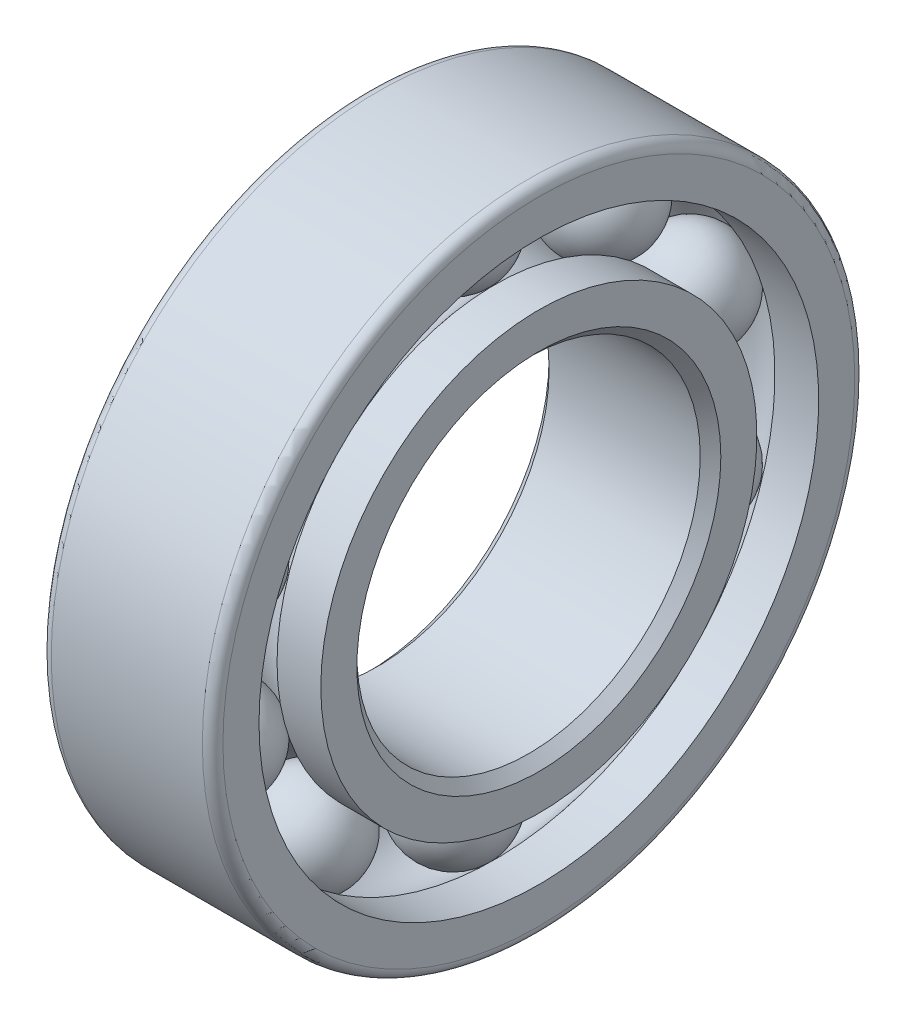
from build123d import *

# Parameters (mm, degrees)
CIRPATTERN2_COUNT = 10
FILLET1_R         = 0.3
CHAMFER1_SIZE     = 0.3


with BuildPart() as part:
    # Sketch1 → Revolve1 (revolve)
    with BuildSketch(Plane(origin=(0, 0, 0), x_dir=(1, 0, 0), z_dir=(0, 1, 0))):
        with BuildLine():
            Line((2.5, 8.15), (2.5, 9.5))
            Line((2.5, 9.5), (-2.5, 9.5))
            Line((-2.5, 9.5), (-2.5, 8.15))
            Line((-2.5, 8.15), (-1.225591592, 8.15))
            ThreePointArc((-1.225591592, 8.15), (0, 8.770550805), (1.225591592, 8.15))
            Line((1.225591592, 8.15), (2.5, 8.15))
        make_face()
        with BuildLine():
            ThreePointArc((1.225591592, 6.35), (0, 5.729449195), (-1.225591592, 6.35))
            Line((-1.225591592, 6.35), (-2.5, 6.35))
            Line((-2.5, 6.35), (-2.5, 5))
            Line((-2.5, 5), (2.5, 5))
            Line((2.5, 5), (2.5, 6.35))
            Line((2.5, 6.35), (1.225591592, 6.35))
        make_face()
    revolve(axis=Axis((-10.301724138, 0, 0), (1, 0, 0)))

    # Fillet1
    fillet1_edges = [part.edges().sort_by_distance(p)[0] for p in [
        (2.5, 0, 9.5),
        (-2.5, 0, 9.5),
    ]]
    fillet(fillet1_edges, radius=FILLET1_R)

    # Chamfer1
    chamfer1_edges = [part.edges().sort_by_distance(p)[0] for p in [
        (2.5, 0, 5),
        (-2.5, 0, 5),
    ]]
    chamfer(chamfer1_edges, length=CHAMFER1_SIZE)


with BuildPart() as body_2:
    # Sketch2 → Revolve2 (revolve)
    with BuildSketch(Plane.XY):
        with BuildLine():
            ThreePointArc((1.5, 7.25), (0, 8.75), (-1.5, 7.25))
            Line((-1.5, 7.25), (1.5, 7.25))
        make_face()
    revolve(axis=Axis((-1.5, 7.25, 0), (1, 0, 0)))


with BuildPart() as cirpattern2_1:
    # CirPattern2: pattern copy
    add(body_2.part.rotate(Axis((2.5, 0, 0), (-1, 0, 0)), 1 * 360 / CIRPATTERN2_COUNT))


with BuildPart() as cirpattern2_2:
    # CirPattern2: pattern copy
    add(body_2.part.rotate(Axis((2.5, 0, 0), (-1, 0, 0)), 2 * 360 / CIRPATTERN2_COUNT))


with BuildPart() as cirpattern2_3:
    # CirPattern2: pattern copy
    add(body_2.part.rotate(Axis((2.5, 0, 0), (-1, 0, 0)), 3 * 360 / CIRPATTERN2_COUNT))


with BuildPart() as cirpattern2_4:
    # CirPattern2: pattern copy
    add(body_2.part.rotate(Axis((2.5, 0, 0), (-1, 0, 0)), 4 * 360 / CIRPATTERN2_COUNT))


with BuildPart() as cirpattern2_5:
    # CirPattern2: pattern copy
    add(body_2.part.rotate(Axis((2.5, 0, 0), (-1, 0, 0)), 5 * 360 / CIRPATTERN2_COUNT))


with BuildPart() as cirpattern2_6:
    # CirPattern2: pattern copy
    add(body_2.part.rotate(Axis((2.5, 0, 0), (-1, 0, 0)), 6 * 360 / CIRPATTERN2_COUNT))


with BuildPart() as cirpattern2_7:
    # CirPattern2: pattern copy
    add(body_2.part.rotate(Axis((2.5, 0, 0), (-1, 0, 0)), 7 * 360 / CIRPATTERN2_COUNT))


with BuildPart() as cirpattern2_8:
    # CirPattern2: pattern copy
    add(body_2.part.rotate(Axis((2.5, 0, 0), (-1, 0, 0)), 8 * 360 / CIRPATTERN2_COUNT))


with BuildPart() as cirpattern2_9:
    # CirPattern2: pattern copy
    add(body_2.part.rotate(Axis((2.5, 0, 0), (-1, 0, 0)), 9 * 360 / CIRPATTERN2_COUNT))


solid = Compound([part.part, body_2.part, cirpattern2_1.part, cirpattern2_2.part, cirpattern2_3.part, cirpattern2_4.part, cirpattern2_5.part, cirpattern2_6.part, cirpattern2_7.part, cirpattern2_8.part, cirpattern2_9.part])
